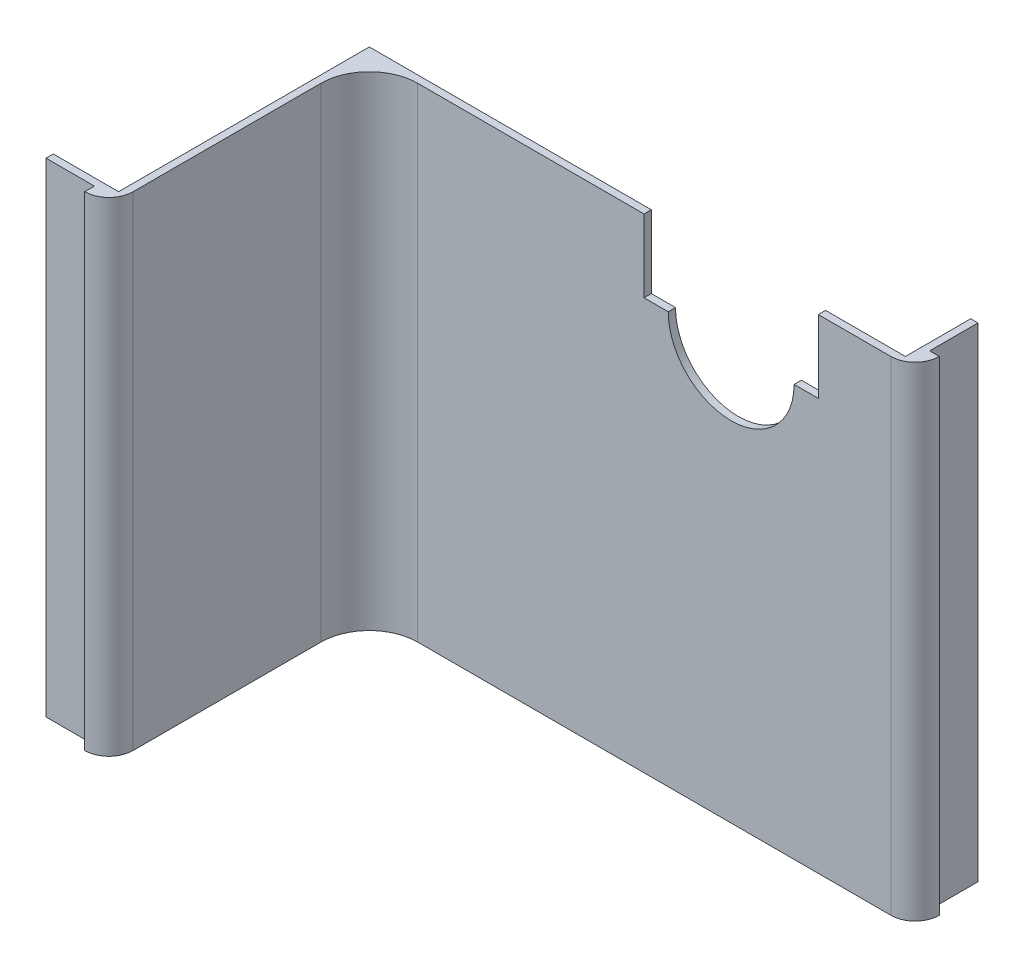
from build123d import *

# Parameters (mm, degrees)
EXTRUDE_1_DEPTH     = 100
CUT_EXTRUDE_1_DEPTH = 168.231641217


with BuildPart() as part:
    # Эскиз1 → Бобышка-Вытянуть1 (new body)
    with BuildSketch(Plane(origin=(0, 0, 0), x_dir=(1, 0, 0), z_dir=(0, 1, 0))):
        with BuildLine():
            Line((0, 0), (-97.768, 0))
            ThreePointArc((-97.768, 0), (-104.839067812, -2.928932188), (-107.768, -10))
            Line((-107.768, -10), (-107.768, -48.8))
            ThreePointArc((-107.768, -48.8), (-109.232466094, -52.335533906), (-112.768, -53.8))
            Line((-112.768, -53.8), (-112.768, -51.8))
            Line((-112.768, -51.8), (-122.768, -51.8))
            Line((-122.768, -51.8), (-122.768, -50.3))
            Line((-122.768, -50.3), (-109.268, -50.3))
            Line((-109.268, -50.3), (-109.268, 1.5))
            Line((-109.268, 1.5), (1.5, 1.5))
            Line((1.5, 1.5), (1.5, 15))
            Line((1.5, 15), (3, 15))
            Line((3, 15), (3, 5))
            Line((3, 5), (5, 5))
            ThreePointArc((5, 5), (3.535533906, 1.464466094), (0, 0))
        make_face()
    extrude(amount=EXTRUDE_1_DEPTH)

    # Эскиз4 → Вырез-Вытянуть1 (cut, through all)
    with BuildSketch(Plane.XY):
        with BuildLine():
            Line((-15, 85), (-20, 85))
            ThreePointArc((-20, 85), (-33, 72), (-46, 85))
            Line((-46, 85), (-51, 85))
            Line((-51, 85), (-51, 100))
            Line((-51, 100), (-15, 100))
            Line((-15, 100), (-15, 85))
        make_face()
    extrude(amount=-CUT_EXTRUDE_1_DEPTH, mode=Mode.SUBTRACT)


solid = part.part
